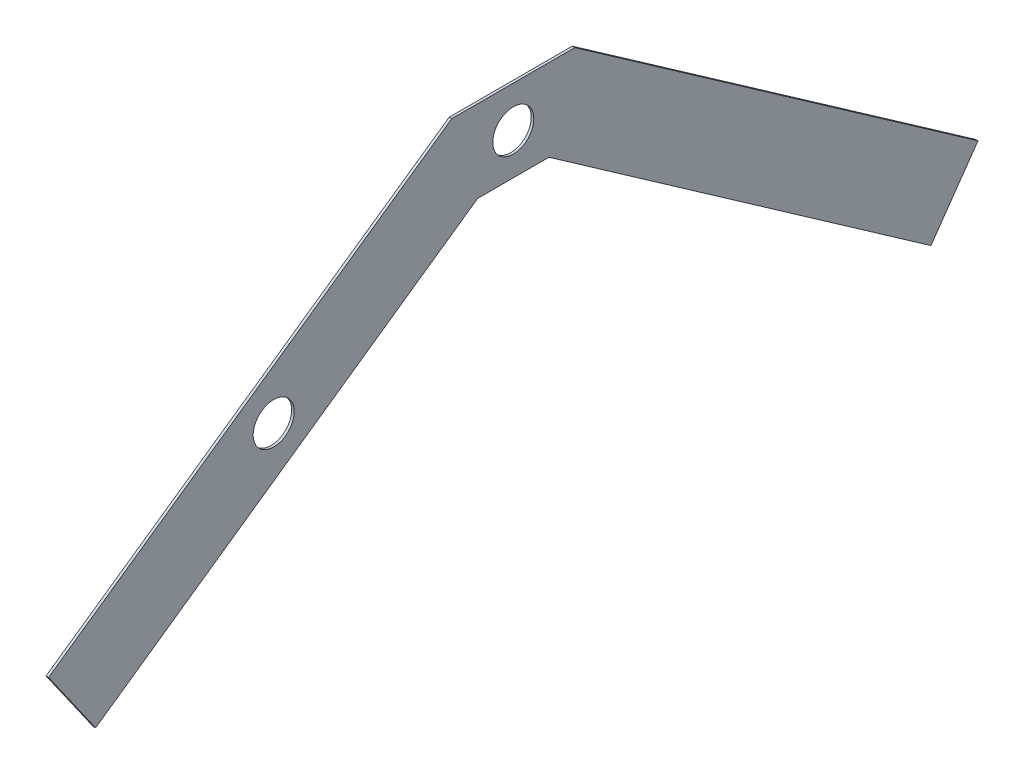
from build123d import *

# Parameters (mm, degrees)
BOSS_EXTRUDE1_DEPTH = 3.175
SKETCH3_R           = 25.4
CUT_EXTRUDE1_DEPTH  = 665.092523558


with BuildPart() as part:
    # Sketch2 → Boss-Extrude1 (new body)
    with BuildSketch(Plane(origin=(0, 0, 0), x_dir=(0, 0, -1), z_dir=(1, 0, 0))):
        Polygon((76.2, 101.6), (-76.2, 101.6), (-575.555086199, -248.0521956), (-517.279720265, -331.278043299), (-44.16564305, 0), (44.16564305, 0), (517.279720265, -331.278043299), (575.555086199, -248.0521956), align=None)
    extrude(amount=BOSS_EXTRUDE1_DEPTH)

    # Sketch3 → Cut-Extrude1 (cut, through all)
    with BuildSketch(Plane(origin=(3.175, 0, 0), x_dir=(0, 0, -1), z_dir=(1, 0, 0))):
        with Locations((0, 50.8)):
            Circle(SKETCH3_R)
        with Locations((-296.739860133, -114.83902165)):
            Circle(SKETCH3_R)
    extrude(amount=-CUT_EXTRUDE1_DEPTH, mode=Mode.SUBTRACT)


solid = part.part
